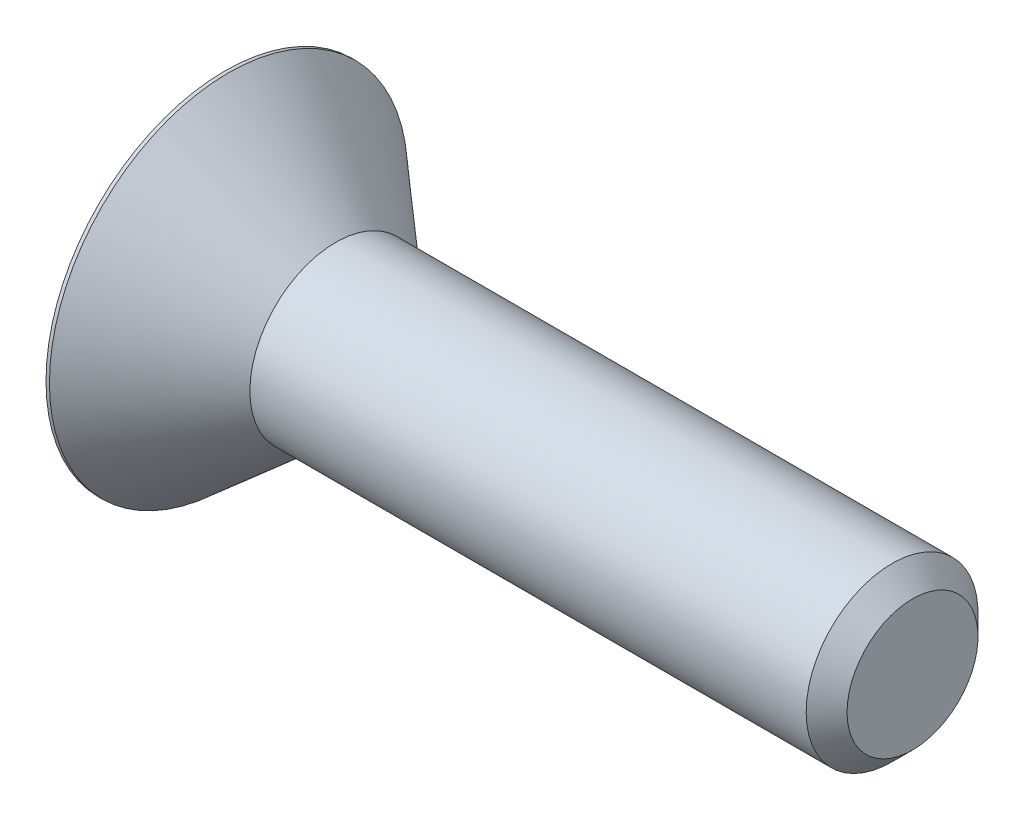
from build123d import *

# Parameters (mm, degrees)
HEX_START   = -2.8194
HEX_2_DEPTH = 2.8194


with BuildPart() as part:
    # BodySke → BaseBody (revolve)
    with BuildSketch(Plane.XY, mode=Mode.PRIVATE) as basebody_sk:
        Polygon((0, 0), (0, 6.61924), (0.127, 6.61924), (4.089144883, 3.175), (24.64435, 3.175), (25.4, 2.41935), (25.4, 0), align=None)
    revolve(basebody_sk.sketch.rotate(Axis((0, 0, 0), (1, 0, 0)), 90), axis=Axis((0, 0, 0), (1, 0, 0)))

    # Hex 2: read off the stored shape, not the designer's step
    # Hex 2 outline → Hex 2 (cut)
    with BuildSketch(Plane.ZY.offset(HEX_START)):
        Polygon((-1.9812, -1.143846353), (0, -2.287692707), (1.9812, -1.143846353), (1.9812, 1.143846353), (0, 2.287692707), (-1.9812, 1.143846353), align=None)
    extrude(amount=HEX_2_DEPTH, mode=Mode.SUBTRACT)

    # Hex 2 2 outline → Hex 2 2 (revolve, cut)
    with BuildSketch(Plane.YX):
        Polygon((1.9812, 2.8194), (0, 3.963246353), (0, 2.8194), align=None)
    revolve(axis=Axis((0, 0, 0), (1, 0, 0)), mode=Mode.SUBTRACT)


solid = part.part
